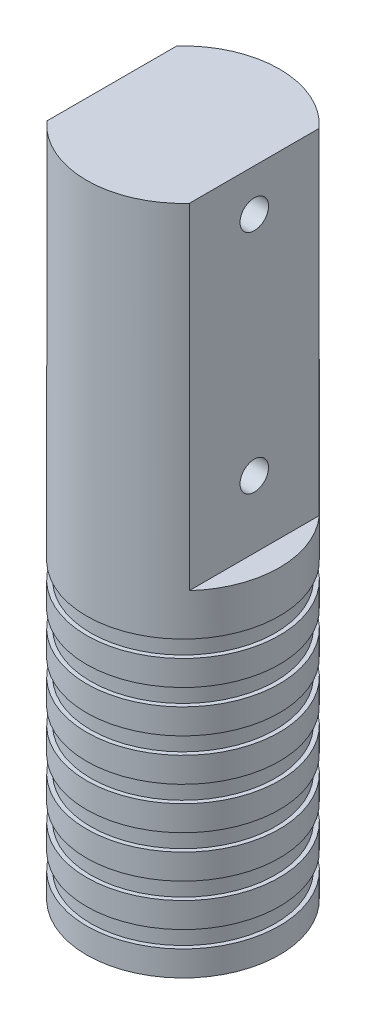
from build123d import *

# Parameters (mm, degrees)
SKETCH2_W                      = 11.5
SKETCH2_H                      = 40
SKETCH3_W                      = 0.5
SKETCH3_H                      = 2
LPATTERN1_COUNT                = 7
LPATTERN1_PITCH                = 5
BOSS_EXTRUDE1_DEPTH            = 40
F_15_0_15_DIAMETER_HOLE1_D     = 15
F_15_0_15_DIAMETER_HOLE1_DEPTH = 40
F_15_0_15_DIAMETER_HOLE1_TIP   = 4.506454643
M3_CLEARANCE_HOLE1_D           = 3.4


with BuildPart() as part:
    # Sketch2 → Revolve1 (revolve)
    with BuildSketch(Plane.XY):
        with Locations((-5.75, -20)):
            Rectangle(SKETCH2_W, SKETCH2_H)
    revolve(axis=Axis((0, 0, 0), (0, -1, 0)))

    # Sketch3 → Cut-Revolve1 (revolve, cut)
    with BuildSketch(Plane.XY):
        with Locations((11.25, -36)):
            Rectangle(SKETCH3_W, SKETCH3_H)
    cut_revolve1 = revolve(axis=Axis((0, 0, 0), (0, -1, 0)), mode=Mode.SUBTRACT)

    # LPattern1: Cut-Revolve1 ×7
    with Locations(*[(0, i * LPATTERN1_PITCH, 0) for i in range(1, LPATTERN1_COUNT)]):
        add(cut_revolve1, mode=Mode.SUBTRACT)

    # Sketch6 → Boss-Extrude1 (add)
    with BuildSketch(Plane(origin=(0, 0, 0), x_dir=(1, 0, 0), z_dir=(0, 1, 0))):
        with BuildLine():
            Line((-8.5, 7.745966692), (-8.5, -7.745966692))
            ThreePointArc((-8.5, -7.745966692), (0, -11.5), (8.5, -7.745966692))
            Line((8.5, -7.745966692), (8.5, 7.745966692))
            ThreePointArc((8.5, 7.745966692), (0, 11.5), (-8.5, 7.745966692))
        make_face()
    extrude(amount=BOSS_EXTRUDE1_DEPTH)

    # Ø15.0 (15) Diameter Hole1
    with Locations(Plane.XZ.offset(40)):
        with Locations((0, 0)):
            Hole(F_15_0_15_DIAMETER_HOLE1_D / 2, depth=F_15_0_15_DIAMETER_HOLE1_DEPTH)
            with Locations((0, 0, -(F_15_0_15_DIAMETER_HOLE1_DEPTH + F_15_0_15_DIAMETER_HOLE1_TIP / 2))):  # 118° drill point
                Cone(0, F_15_0_15_DIAMETER_HOLE1_D / 2, F_15_0_15_DIAMETER_HOLE1_TIP, mode=Mode.SUBTRACT)

    # M3 Clearance Hole1 (through all)
    with Locations(Plane(origin=(8.5, 0, 0), x_dir=(0, 0, -1), z_dir=(1, 0, 0))):
        with Locations((0, 8), (0, 35)):
            Hole(M3_CLEARANCE_HOLE1_D / 2)


solid = part.part
